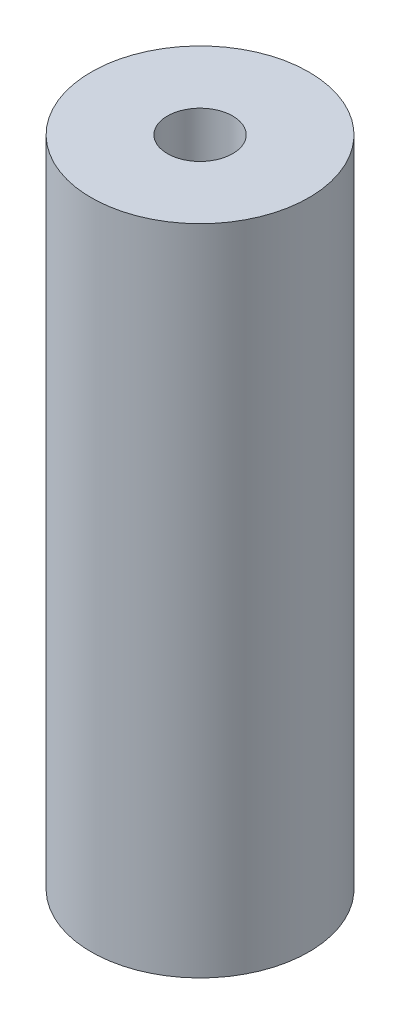
from build123d import *


with BuildPart() as part:
    # Sketch1 → Revolve1 (revolve)
    with BuildSketch(Plane.XY):
        Polygon((-0.75, 15), (-0.75, 8), (-1.5, 8), (-1.5, 0), (-2.5, 0), (-2.5, 15), align=None)
    revolve(axis=Axis((0, 0, 0), (0, 1, 0)))


solid = part.part
